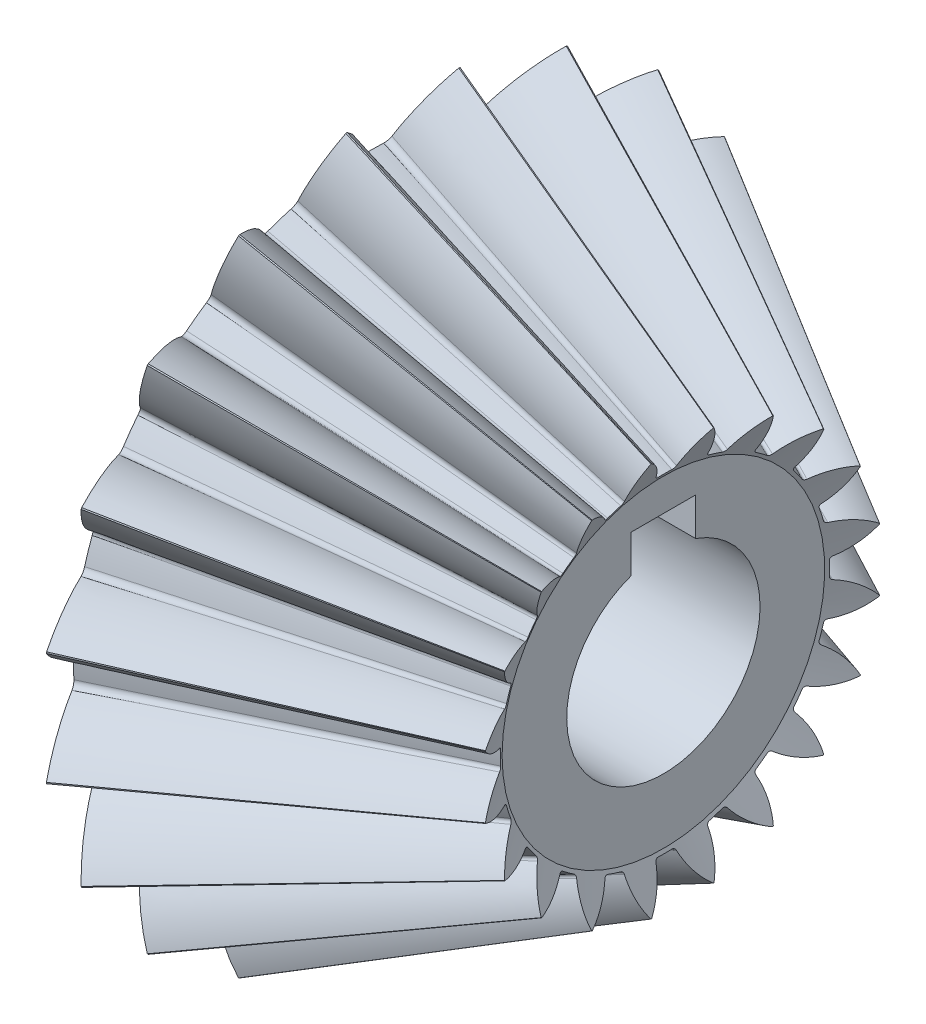
from build123d import *

# Parameters (mm, degrees)
TEETHCUTS_COUNT = 20
TEETHCUTS_ANGLE = 342
HUBSKE_R        = 3
HUB_DEPTH       = 9.528291257
BORSKE_R        = 3
BORE_DEPTH      = 30.0000508
KEYSKE_W        = 2
KEYSKE_H        = 4
KEYWAY_DEPTH    = 30.0000508


with BuildPart() as part:
    # BasProSke → Base-Revolve (revolve)
    with BuildSketch(Plane(origin=(0, 0, 0), x_dir=(1, 0, 0), z_dir=(0, 1, 0)), mode=Mode.PRIVATE) as base_revolve_sk:
        Polygon((0, 0), (0, 9.056379314), (1.07331263, 11.203004572), (9.748584537, 6.192868611), (9.155271908, 5.006243354), (9.155271908, 0), align=None)
    revolve(base_revolve_sk.sketch.rotate(Axis((-10, 0, 0), (1, 0, 0)), 180), axis=Axis((-10, 0, 0), (1, 0, 0)))

    # ToothCut: read off the stored shape, not the designer's step
    # ToothCut: loft between two sections, ruled curve by curve
    toothcut_from = [
        Edge.make_bspline([(20.475175686, 0.006730684, -0.010230454), (20.472620769, 0.00162085, -0.014432703), (20.469472441, -0.004675805, -0.01357417), (20.467444062, -0.008732563, -0.008122078)], [0, 0, 0, 0, 1, 1, 1, 1], 3, [1, 0.818595861, 0.818595861, 1]),
        Edge.make_bspline([(20.467444062, -0.008732563, 0.008122078), (20.469472441, -0.004675805, 0.01357417), (20.472620769, 0.00162085, 0.014432703), (20.475175686, 0.006730684, 0.010230454)], [0, 0, 0, 0, 1, 1, 1, 1], 3, [1, 0.818595861, 0.818595861, 1]),
        Edge.make_bspline([(20.467444062, -0.008732563, -0.008122078), (20.467124412, -0.009371863, -0.007262889), (20.466857955, -0.009904777, -0.006317325), (20.466649302, -0.010322084, -0.005301744)], [0, 0, 0, 0, 1, 1, 1, 1], 3, [1, 0.994233588, 0.994233588, 1]),
        Edge.make_bspline([(20.466649302, -0.010322084, 0.005301744), (20.466857955, -0.009904777, 0.006317325), (20.467124412, -0.009371863, 0.007262889), (20.467444062, -0.008732563, 0.008122078)], [0, 0, 0, 0, 1, 1, 1, 1], 3, [1, 0.994233588, 0.994233588, 1]),
        Edge.make_bspline([(20.466649302, -0.010322084, -0.005301744), (20.465946663, -0.011727361, -0.001881792), (20.465946663, -0.011727361, 0.001881792), (20.466649302, -0.010322084, 0.005301744)], [0, 0, 0, 0, 1, 1, 1, 1], 3, [1, 0.939130155, 0.939130155, 1]),
        Edge.make_line((20.475175686, 0.006730684, 0.010230454), (20.475175686, 0.006730684, -0.010230454)),
    ]
    toothcut_to = [
        Edge.make_bspline([(1.101068829, 11.258516969, -1.946212593), (0.857940224, 10.77225976, -1.2651625), (0.53110282, 10.118584953, -0.790532769), (0.153974829, 9.364328972, -0.570852964)], [0, 0, 0, 0, 1, 1, 1, 1], 3, [1, 0.965917598, 0.965917598, 1]),
        Edge.make_bspline([(0.153974829, 9.364328972, 0.570852964), (0.53110282, 10.118584953, 0.790532769), (0.857940224, 10.77225976, 1.2651625), (1.101068829, 11.258516969, 1.946212593)], [0, 0, 0, 0, 1, 1, 1, 1], 3, [1, 0.965917598, 0.965917598, 1]),
        Edge.make_bspline([(0.153974829, 9.364328972, -0.570852964), (0.113805435, 9.283990183, -0.547453999), (0.089108685, 9.234596684, -0.472849938), (0.090831971, 9.238043256, -0.380110711)], [0, 0, 0, 0, 1, 1, 1, 1], 3, [1, 0.852242502, 0.852242502, 1]),
        Edge.make_bspline([(0.090831971, 9.238043256, 0.380110711), (0.089108685, 9.234596684, 0.472849938), (0.113805435, 9.283990183, 0.547453999), (0.153974829, 9.364328972, 0.570852964)], [0, 0, 0, 0, 1, 1, 1, 1], 3, [1, 0.852242502, 0.852242502, 1]),
        Edge.make_bspline([(0.090831971, 9.238043256, -0.380110711), (0.095539445, 9.247458203, -0.126776434), (0.095539445, 9.247458203, 0.126776434), (0.090831971, 9.238043256, 0.380110711)], [0, 0, 0, 0, 1, 1, 1, 1], 3, [1, 0.999425256, 0.999425256, 1]),
        Edge.make_line((1.101068829, 11.258516969, 1.946212593), (1.101068829, 11.258516969, -1.946212593)),
    ]
    toothcut = Solid(Shell([*[Face.make_surface_from_curves(toothcut_from[k], toothcut_to[k]) for k in range(6)], Face(Wire(toothcut_from)), Face(Wire(toothcut_to))]))
    add(toothcut, mode=Mode.SUBTRACT)

    # TeethCuts: ToothCut ×20 about axis
    teethcuts_axis = Axis((-10, 0, 0), (1, 0, 0))
    for i in range(1, TEETHCUTS_COUNT):
        add(toothcut.rotate(teethcuts_axis, i * TEETHCUTS_ANGLE / (TEETHCUTS_COUNT - 1)), mode=Mode.SUBTRACT)

    # HubSke → Hub (add)
    with BuildSketch(Plane.ZY):
        with Locations(Location((0, 0, 0), (0, 0, 180))):
            Circle(HUBSKE_R)
    extrude(amount=HUB_DEPTH)

    # BorSke → Bore (cut, symmetric)
    with BuildSketch(Plane(origin=(0, 0, 0), x_dir=(0, 0, -1), z_dir=(1, 0, 0))):
        with Locations(Location((0, 0, 0), (0, 0, 180))):
            Circle(BORSKE_R)
    extrude(amount=BORE_DEPTH, both=True, mode=Mode.SUBTRACT)

    # KeySke → Keyway (cut, symmetric)
    with BuildSketch(Plane(origin=(0, 0, 0), x_dir=(0, 0, -1), z_dir=(1, 0, 0))):
        with Locations((0, 2)):
            Rectangle(KEYSKE_W, KEYSKE_H)
    extrude(amount=KEYWAY_DEPTH, both=True, mode=Mode.SUBTRACT)


solid = part.part
